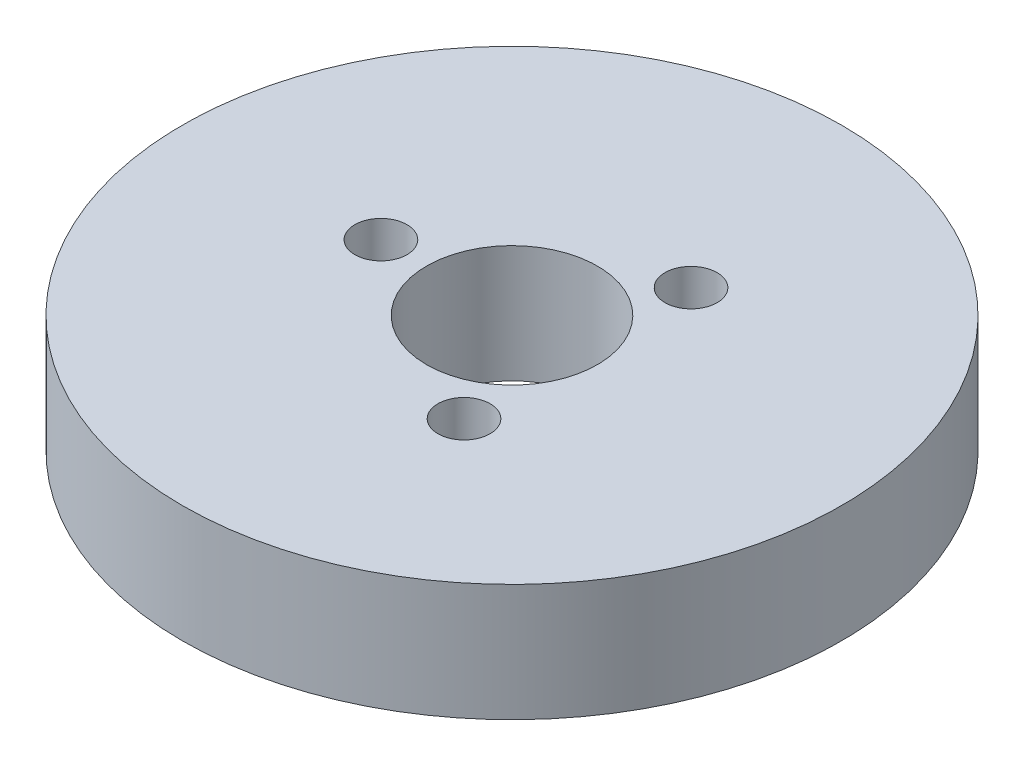
from build123d import *

# Parameters (mm, degrees)
SKETCH1_R           = 67.5
BOSS_EXTRUDE1_DEPTH = 24
SKETCH2_R           = 17.5
CUT_EXTRUDE1_DEPTH  = 99.430178299
SKETCH3_R           = 5.338837042
CUT_EXTRUDE2_DEPTH  = 15.747173094
CIRPATTERN1_COUNT   = 3


with BuildPart() as part:
    # Sketch1 → Boss-Extrude1 (new body)
    with BuildSketch(Plane(origin=(0, 0, 0), x_dir=(1, 0, 0), z_dir=(0, 1, 0))):
        Circle(SKETCH1_R)
    extrude(amount=BOSS_EXTRUDE1_DEPTH)

    # Sketch2 → Cut-Extrude1 (cut, through all)
    with BuildSketch(Plane(origin=(0, 0, 0), x_dir=(1, 0, 0), z_dir=(0, 1, 0))):
        Circle(SKETCH2_R)
    extrude(amount=CUT_EXTRUDE1_DEPTH, mode=Mode.SUBTRACT)

    # Sketch3 → Cut-Extrude2 (cut)
    with BuildSketch(Plane(origin=(0, 24, 0), x_dir=(1, 0, 0), z_dir=(0, 1, 0))):
        with Locations((-26.846719931, 0)):
            Circle(SKETCH3_R)
    cut_extrude2 = extrude(amount=-CUT_EXTRUDE2_DEPTH, mode=Mode.SUBTRACT)

    # CirPattern1: Cut-Extrude2 ×3 about axis
    cirpattern1_axis = Axis((0, 0, 0), (0, 1, 0))
    for i in range(1, CIRPATTERN1_COUNT):
        add(cut_extrude2.rotate(cirpattern1_axis, i * 360 / CIRPATTERN1_COUNT), mode=Mode.SUBTRACT)


solid = part.part
